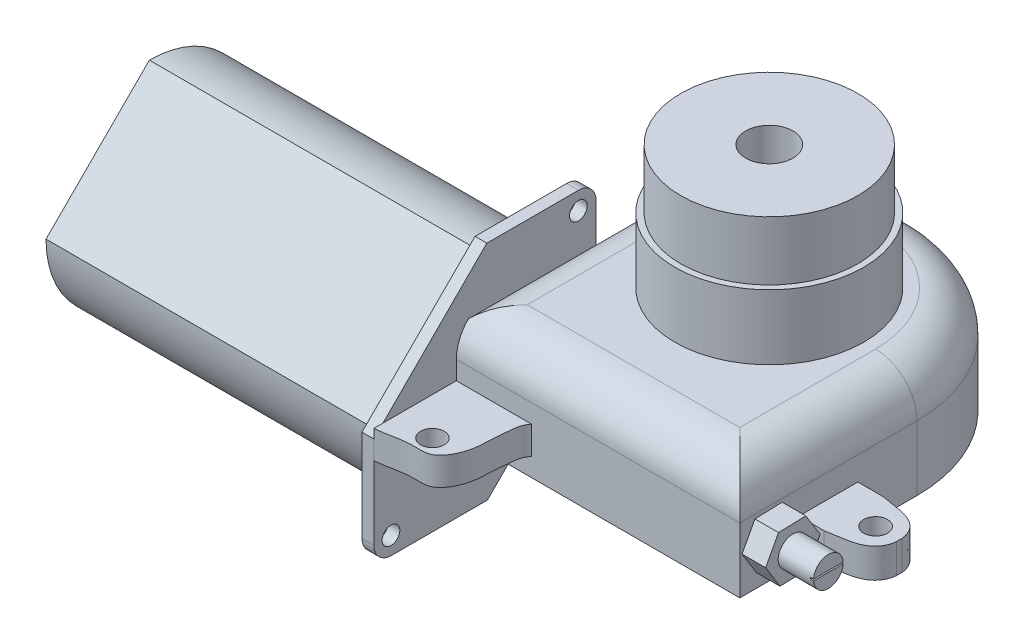
from build123d import *

# Parameters (mm, degrees)
SKETCH2_W                = 50
SKETCH2_H                = 18
BOSS_EXTRUDE1_DEPTH      = 60
CUT_EXTRUDE1_DEPTH       = 50
SKETCH4_R                = 16
BOSS_EXTRUDE2_DEPTH      = 11
SKETCH5_R                = 15
BOSS_EXTRUDE3_DEPTH      = 10
SKETCH6_R                = 4
CUT_EXTRUDE2_DEPTH       = 45
FILLET1_R                = 7
FILLET6_R                = 7
SKETCH7_W                = 10
SKETCH7_H                = 5
BOSS_EXTRUDE4_DEPTH      = 12
SKETCH8_R                = 2.017979808
CUT_EXTRUDE3_DEPTH       = 10
CUT_EXTRUDE4_DEPTH       = 10
BOSS_EXTRUDE5_DEPTH      = 4
BOSS_EXTRUDE6_DEPTH      = 6
BOSS_EXTRUDE6_DEPTH_BACK = 73
SKETCH12_R               = 2.5
SKETCH15_W               = 6.308184524
SKETCH15_H               = 0.262670096
CUT_EXTRUDE6_DEPTH       = 0.5
BOSS_EXTRUDE7_DEPTH      = 55
SKETCH22_R               = 8.328168783
BOSS_EXTRUDE8_DEPTH      = 3
SKETCH23_R               = 2.62195597
BOSS_EXTRUDE9_DEPTH      = 2
FILLET7_R                = 2
FILLET8_R                = 1
BOSS_EXTRUDE10_DEPTH     = 2
SKETCH25_R               = 1.5
CUT_EXTRUDE7_DEPTH       = 2
SKETCH27_W               = 12.756486499
SKETCH27_H               = 4.738083454
BOSS_EXTRUDE11_DEPTH     = 14
SKETCH28_R               = 2
CUT_EXTRUDE8_DEPTH       = 14


with BuildPart() as part:
    # Sketch2 → Boss-Extrude1 (new body)
    with BuildSketch(Plane.XY):
        Rectangle(SKETCH2_W, SKETCH2_H)
    extrude(amount=-BOSS_EXTRUDE1_DEPTH)

    # Sketch3 → Cut-Extrude1 (cut)
    with BuildSketch(Plane(origin=(0, 9, 0), x_dir=(1, 0, 0), z_dir=(0, 1, 0))):
        with BuildLine():
            Line((0, 55), (0, 60))
            Line((0, 60), (-25, 60))
            Line((-25, 60), (-25, 30))
            ThreePointArc((-25, 30), (-17.67766953, 47.67766953), (0, 55))
        make_face()
        with BuildLine():
            Line((25, 60), (0, 60))
            Line((0, 60), (0, 55))
            ThreePointArc((0, 55), (17.67766953, 47.67766953), (25, 30))
            Line((25, 30), (25, 60))
        make_face()
    extrude(amount=-CUT_EXTRUDE1_DEPTH, mode=Mode.SUBTRACT)

    # Sketch4 → Boss-Extrude2 (add)
    with BuildSketch(Plane(origin=(0, 9, 0), x_dir=(1, 0, 0), z_dir=(0, 1, 0))):
        with Locations(Location((0, 30, 0), (0, 0, 270))):
            Circle(SKETCH4_R)
    extrude(amount=BOSS_EXTRUDE2_DEPTH)

    # Sketch5 → Boss-Extrude3 (add)
    with BuildSketch(Plane(origin=(0, 20, 0), x_dir=(1, 0, 0), z_dir=(0, 1, 0))):
        with Locations(Location((0, 30, 0), (0, 0, 270))):
            Circle(SKETCH5_R)
    extrude(amount=BOSS_EXTRUDE3_DEPTH)

    # Sketch6 → Cut-Extrude2 (cut)
    with BuildSketch(Plane(origin=(0, 30, 0), x_dir=(1, 0, 0), z_dir=(0, 1, 0))):
        with Locations(Location((0, 30, 0), (0, 0, 270))):
            Circle(SKETCH6_R)
    extrude(amount=-CUT_EXTRUDE2_DEPTH, mode=Mode.SUBTRACT)

    # Fillet1
    fillet1_edges = [part.edges().sort_by_distance(p)[0] for p in [
        (0, 9, 0),
    ]]
    fillet(fillet1_edges, radius=FILLET1_R)

    # Fillet6
    # the kernel refuses this fillet: 7 mm, written as the material it takes off along each edge
    with BuildSketch(Plane(origin=(-25, 9, 10.5), x_dir=(0, -1, 0), z_dir=(0, 0, -1))) as fillet6_piece_1:
        with BuildLine():
            CenterArc((FILLET6_R, -FILLET6_R), FILLET6_R, 90, 90)
            Line((0, -FILLET6_R), (0, 0))
            Line((0, 0), (FILLET6_R, 0))
        make_face()
    extrude(amount=40.5, mode=Mode.SUBTRACT)
    with BuildSketch(Plane(origin=(0, 9, -30), x_dir=(-1, 0, 0), z_dir=(0, 0, 1))) as fillet6_piece_2:
        with BuildLine():
            CenterArc((25 - FILLET6_R, FILLET6_R), FILLET6_R, 270, 90)
            Line((25, FILLET6_R), (25, 0))
            Line((25, 0), (25 - FILLET6_R, 0))
        make_face()
    revolve(axis=Axis((0, 9, -30), (0, -1, 0)), revolution_arc=180, mode=Mode.SUBTRACT)
    with BuildSketch(Plane(origin=(25, 9, 10.5), x_dir=(0, -1, 0), z_dir=(0, 0, -1))) as fillet6_piece_3:
        with BuildLine():
            CenterArc((FILLET6_R, FILLET6_R), FILLET6_R, 180, 90)
            Line((0, FILLET6_R), (0, 0))
            Line((0, 0), (FILLET6_R, 0))
        make_face()
    extrude(amount=40.5, mode=Mode.SUBTRACT)

    # Sketch7 → Boss-Extrude4 (add)
    with BuildSketch(Plane(origin=(25, 0, 0), x_dir=(0, 0, -1), z_dir=(1, 0, 0))):
        with Locations((15, -4.5)):
            Rectangle(SKETCH7_W, SKETCH7_H)
    extrude(amount=BOSS_EXTRUDE4_DEPTH)

    # Sketch8 → Cut-Extrude3 (cut)
    with BuildSketch(Plane(origin=(0, -7, 0), x_dir=(-1, 0, 0), z_dir=(0, -1, 0))):
        with Locations(Location((-33, 15, 0), (0, 0, 90))):
            Circle(SKETCH8_R)
    extrude(amount=-CUT_EXTRUDE3_DEPTH, mode=Mode.SUBTRACT)

    # Sketch9 → Cut-Extrude4 (cut)
    with BuildSketch(Plane.XZ.offset(7)):
        with BuildLine():
            Line((37, -20), (37, -15.487118702))
            add(Edge.make_bspline(
                [(29.301025402, -20), (31.159014878, -19.577955894), (35.343998587, -19.634790074), (36.930791765, -16.465392679), (37, -15.487118702)],
                knots=[0, 0, 0, 0, 0.665986255, 0.952522337, 0.952522337, 0.952522337, 0.952522337], degree=3))
            Line((29.301025402, -20), (37, -20))
        make_face()
        with BuildLine():
            Line((37, -10), (29.301025402, -10))
            add(Edge.make_bspline(
                [(29.301025402, -10), (31.159014878, -10.422044106), (35.343998587, -10.365209926), (36.930791765, -13.534607321), (37, -14.512881298)],
                knots=[0, 0, 0, 0, 0.665986255, 0.952522337, 0.952522337, 0.952522337, 0.952522337], degree=3))
            Line((37, -14.512881298), (37, -10))
        make_face()
    extrude(amount=-CUT_EXTRUDE4_DEPTH, mode=Mode.SUBTRACT)

    # Sketch10 → Boss-Extrude5 (add)
    with BuildSketch(Plane(origin=(25, 0, 0), x_dir=(0, 0, -1), z_dir=(1, 0, 0))):
        Polygon((7.181671506, 1.449117939), (2.565182327, 1.302963931), (0.383510821, -2.768109978), (2.818328494, -6.693029879), (7.434817673, -6.546875871), (9.616489179, -2.475801962), align=None)
    extrude(amount=BOSS_EXTRUDE5_DEPTH)

    # Sketch12 → Boss-Extrude6 (add, two sides: drawn at the far end of the back side and taken through both)
    with BuildSketch(Plane(origin=(29, 0, 0), x_dir=(0, 0, -1), z_dir=(1, 0, 0)).offset(-BOSS_EXTRUDE6_DEPTH_BACK)):
        with Locations((5, -2.62195597)):
            Circle(SKETCH12_R)
    extrude(amount=BOSS_EXTRUDE6_DEPTH + BOSS_EXTRUDE6_DEPTH_BACK)

    # Sketch15 → Cut-Extrude6 (cut)
    with BuildSketch(Plane(origin=(35, 0, 0), x_dir=(0, 0, -1), z_dir=(1, 0, 0))):
        with Locations((5, -2.62195597)):
            Rectangle(SKETCH15_W, SKETCH15_H)
    extrude(amount=-CUT_EXTRUDE6_DEPTH, mode=Mode.SUBTRACT)

    # Sketch16 → Boss-Extrude7 (add)
    with BuildSketch(Plane.ZY.offset(25)):
        with BuildLine():
            Line((-5, 14.87804403), (12.5, -2.62195597))
            ThreePointArc((12.5, -2.62195597), (7.374368671, -14.996324641), (-5, -20.12195597))
            Line((-5, -20.12195597), (-22.5, -2.62195597))
            ThreePointArc((-22.5, -2.62195597), (-17.374368671, 9.752412701), (-5, 14.87804403))
        make_face()
    extrude(amount=BOSS_EXTRUDE7_DEPTH)

    # Sketch22 → Boss-Extrude8 (add)
    with BuildSketch(Plane.ZY.offset(80)):
        with Locations((-5, -2.62195597)):
            Circle(SKETCH22_R)
    extrude(amount=BOSS_EXTRUDE8_DEPTH)

    # Sketch23 → Boss-Extrude9 (add)
    with BuildSketch(Plane.ZY.offset(83)):
        with Locations((-5, -2.62195597)):
            Circle(SKETCH23_R)
    extrude(amount=BOSS_EXTRUDE9_DEPTH)

    # Fillet7
    fillet7_edges = [part.edges().sort_by_distance(p)[0] for p in [
        (-83, -2.62195597, -13.328168783),
    ]]
    fillet(fillet7_edges, radius=FILLET7_R)

    # Fillet8
    fillet8_edges = [part.edges().sort_by_distance(p)[0] for p in [
        (-85, -2.62195597, -7.62195597),
    ]]
    fillet(fillet8_edges, radius=FILLET8_R)

    # Sketch24 → Boss-Extrude10 (add)
    with BuildSketch(Plane(origin=(-25, 0, 0), x_dir=(0, 0, -1), z_dir=(1, 0, 0))):
        with BuildLine():
            Line((-13.980304455, -2.688046863), (5.159392937, 16.451650529))
            Line((5.159392937, 16.451650529), (20.658441278, 16.451650529))
            ThreePointArc((20.658441278, 16.451650529), (22.779761622, 15.572970872), (23.658441278, 13.451650529))
            Line((23.658441278, 13.451650529), (23.658441278, -2.877728254))
            Line((23.658441278, -2.877728254), (5.255772284, -21.280397249))
            Line((5.255772284, -21.280397249), (-10.980304455, -21.280397249))
            ThreePointArc((-10.980304455, -21.280397249), (-13.101624798, -20.401717592), (-13.980304455, -18.280397249))
            Line((-13.980304455, -18.280397249), (-13.980304455, -2.688046863))
        make_face()
    extrude(amount=BOSS_EXTRUDE10_DEPTH)

    # Sketch25 → Cut-Extrude7 (cut)
    with BuildSketch(Plane.ZY.offset(25)):
        with Locations((-20.658441278, 13.451650529)):
            Circle(SKETCH25_R)
        with Locations(Location((11.073606499, -18.280397249, 0), (0, 0, 180))):
            Circle(SKETCH25_R)
    extrude(amount=-CUT_EXTRUDE7_DEPTH, mode=Mode.SUBTRACT)

    # Sketch27 → Boss-Extrude11 (add)
    with BuildSketch(Plane.XY):
        with Locations((-16.621756751, -3.512365056)):
            Rectangle(SKETCH27_W, SKETCH27_H)
    extrude(amount=BOSS_EXTRUDE11_DEPTH)

    # Sketch28 → Cut-Extrude8 (cut)
    with BuildSketch(Plane(origin=(0, -5.881406783, 0), x_dir=(-1, 0, 0), z_dir=(0, -1, 0))):
        with BuildLine():
            add(Edge.make_bspline(
                [(23, -13.980304455), (21.040358256, -13.849946774), (18.327335378, -12.869508638), (14.76618265, -13.383152912), (13.195630898, -12.157690347), (12.453642875, -10.967120732), (11.825664424, -9.487701946), (11.427276145, -7.580341481), (11.452990141, -5.432672222), (11.129880797, -2.792351119), (11.084820543, -0.923222192), (10.243513501, 0)],
                knots=[0, 0, 0, 0, 0.253392468, 0.384448091, 0.437710576, 0.505134134, 0.567821926, 0.648624813, 0.759593973, 0.849288238, 1, 1, 1, 1], degree=3))
            Line((10.243513501, 0), (10.243513501, -14))
            Line((10.243513501, -14), (23, -14))
            Line((23, -14), (23, -13.980304455))
        make_face()
        with Locations(Location((16.62175675, -10.436159793, 0), (0, 0, 90))):
            Circle(SKETCH28_R)
    extrude(amount=-CUT_EXTRUDE8_DEPTH, mode=Mode.SUBTRACT)


solid = part.part
